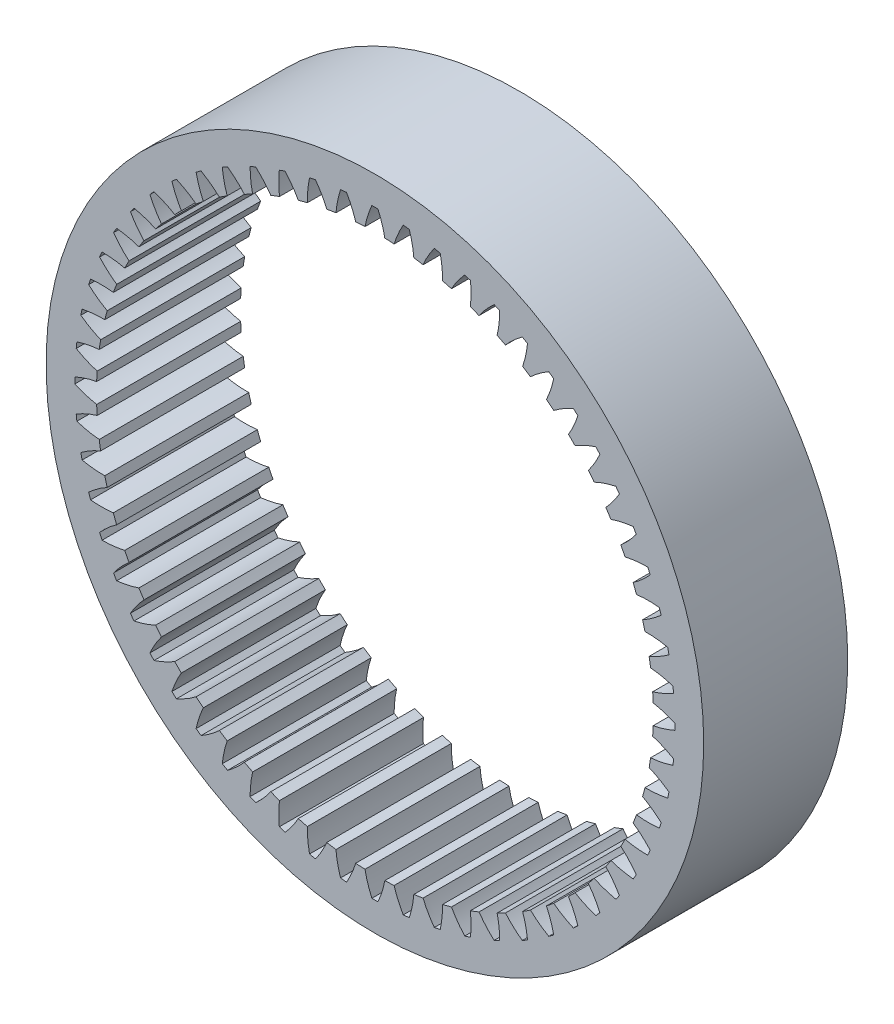
from build123d import *

# Parameters (mm, degrees)
SKETCH_998_R                = 68.5
SKETCH_998_R_2              = 58
EXTRUDE_1006_DEPTH          = 15
CUT_EXTRUDE_1538_DEPTH      = 15
PATTERN_CIRCULAR_1591_COUNT = 60


with BuildPart() as part:
    # Sketch 998 → Extrude 1006 (new, symmetric)
    with BuildSketch(Plane.XY):
        Circle(SKETCH_998_R)
        Circle(SKETCH_998_R_2, mode=Mode.SUBTRACT)
    extrude(amount=EXTRUDE_1006_DEPTH, both=True)

    # Sketch 1130 → Cut-Extrude 1538 (cut, symmetric)
    with BuildSketch(Plane.XY):
        with BuildLine():
            add(Edge.make_bspline(
                [(-2.063152663, 57.963293567), (-2.059682959, 57.982977611), (-2.022216692, 58.193119803), (-1.942515654, 58.592238754), (-1.759948931, 59.365110433), (-1.426237385, 60.48826351), (-1.091699769, 61.407455318), (-0.793292793, 62.132623848), (-0.634988335, 62.496774235)],
                knots=[0.00534284, 0.00534284, 0.00534284, 0.00534284, 0.00534284, 0.005604068, 0.008132613, 0.010661158, 0.015718248, 0.020907777, 0.020907777, 0.020907777, 0.020907777, 0.020907777], degree=4))
            ThreePointArc((-2.063152663, 57.963293567), (0, 58), (2.063152663, 57.963293567))
            add(Edge.make_bspline(
                [(2.063152663, 57.963293567), (2.059682959, 57.982977611), (2.022216692, 58.193119803), (1.942515654, 58.592238754), (1.759948931, 59.365110433), (1.426237385, 60.48826351), (1.091699769, 61.407455318), (0.793292793, 62.132623848), (0.634988335, 62.496774235)],
                knots=[0.00534284, 0.00534284, 0.00534284, 0.00534284, 0.00534284, 0.005604068, 0.008132613, 0.010661158, 0.015718248, 0.020907777, 0.020907777, 0.020907777, 0.020907777, 0.020907777], degree=4))
            ThreePointArc((0.634988335, 62.496774235), (0, 62.5), (-0.634988335, 62.496774235))
        make_face()
    cut_extrude_1538 = extrude(amount=CUT_EXTRUDE_1538_DEPTH, both=True, mode=Mode.SUBTRACT)

    # Pattern Circular 1591: Cut-Extrude 1538 ×60 about axis
    pattern_circular_1591_axis = Axis((0, 0, 15), (0, 0, -1))
    for i in range(1, PATTERN_CIRCULAR_1591_COUNT):
        add(cut_extrude_1538.rotate(pattern_circular_1591_axis, i * 360 / PATTERN_CIRCULAR_1591_COUNT), mode=Mode.SUBTRACT)


solid = part.part
